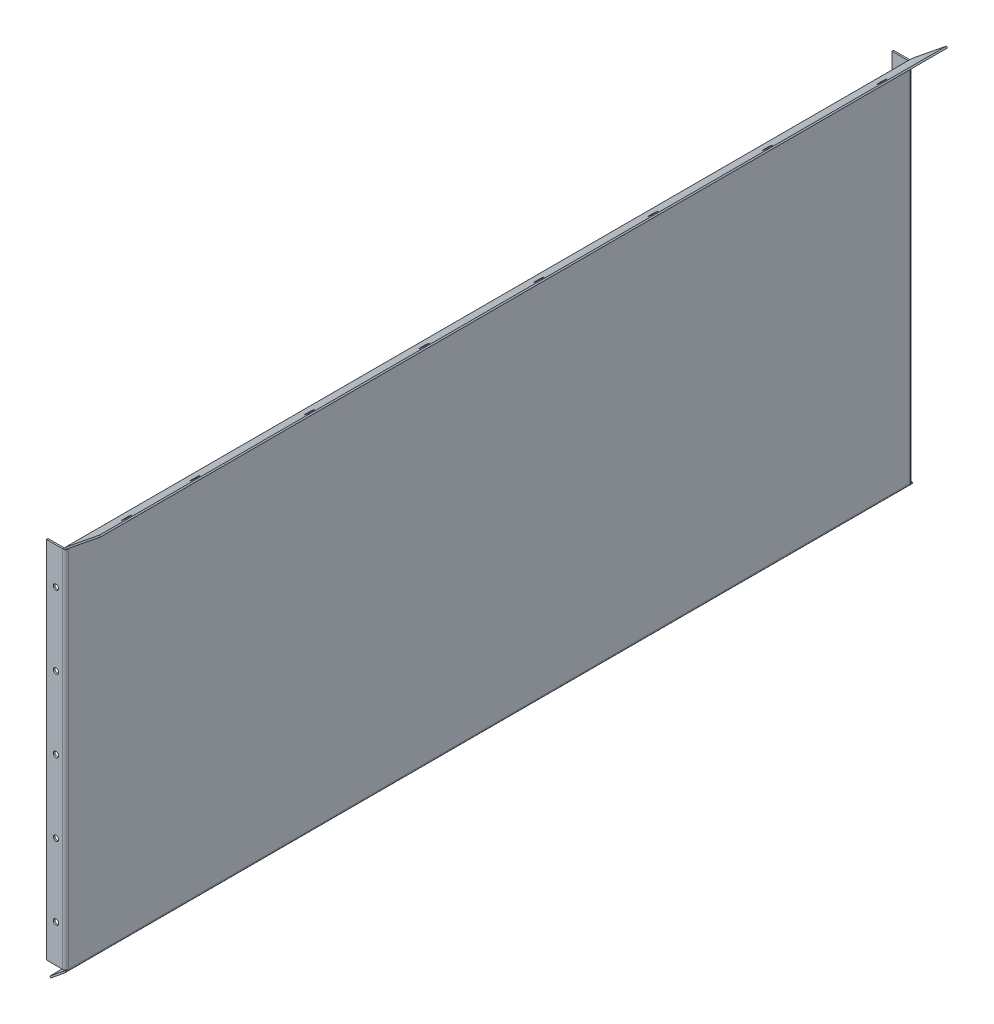
from build123d import *

# Parameters (mm, degrees)
SKETCH1_W                    = 2220
SKETCH1_H                    = 969
BASE_FLANGE1_DEPTH           = 4
EDGE_FLANGE1_START           = -788.522727273
EDGE_FLANGE1_DEPTH           = 2220
EDGE_FLANGE1_2_DEPTH         = 2220
EDGE_FLANGE2_START           = -788.522727273
EDGE_FLANGE2_DEPTH           = 2220
EDGE_FLANGE2_2_DEPTH         = 2220
EDGE_FLANGE3_STRIP_W         = 24
EDGE_FLANGE3_STRIP_H         = 4
EDGE_FLANGE3_STRIP_CUT_DEPTH = 954.890119211
EDGE_FLANGE3_DEPTH           = 954.890119211
EDGE_FLANGE4_STRIP_W         = 24
EDGE_FLANGE4_STRIP_H         = 4
EDGE_FLANGE4_STRIP_CUT_DEPTH = 954.890119211
EDGE_FLANGE4_DEPTH           = 954.890119211
CUT_EXTRUDE1_DEPTH           = 1665.596730593
LPATTERN1_COUNT              = 7
LPATTERN1_PITCH              = 300
CUT_EXTRUDE2_DEPTH           = 1665.596730593
CUT_EXTRUDE2_DEPTH_BACK      = 1665.596730593
SKETCH20_R                   = 7
CUT_EXTRUDE3_DEPTH           = 2327.247497544
LPATTERN2_COUNT              = 5
LPATTERN2_PITCH              = 190
CUT_EXTRUDE4_DEPTH           = 1704.160586281
LPATTERN3_COUNT              = 7
LPATTERN3_PITCH              = 300
CUT_EXTRUDE5_DEPTH           = 1704.160586281
CUT_EXTRUDE5_DEPTH_BACK      = 1704.160586281


# Read off the part's stored shape, not the designer's step: Edge-Flange1, Edge-Flange2
# Sheet-metal steps are written as plain solids
with BuildPart() as part:
    # Sketch1 → Base-Flange1 (new body)
    with BuildSketch(Plane(origin=(0, 0, 0), x_dir=(0, 0, -1), z_dir=(1, 0, 0))):
        with Locations((-321.477272727, 132.136363636)):
            Rectangle(SKETCH1_W, SKETCH1_H)
    extrude(amount=-BASE_FLANGE1_DEPTH)

    # Edge-Flange1 outline → Edge-Flange1 (cut)
    with BuildSketch(Plane.XY.offset(EDGE_FLANGE1_START)):
        with BuildLine():
            ThreePointArc((-4, 609.581423242), (-3.220682275, 613.025512017), (-1.034563128, 615.798590934))
            Line((-1.034563128, 615.798590934), (0, 616.636363636))
            Line((0, 616.636363636), (-4, 616.636363636))
            Line((-4, 616.636363636), (-4, 609.581423242))
        make_face()
    extrude(amount=EDGE_FLANGE1_DEPTH, mode=Mode.SUBTRACT)

    # Edge-Flange1 2 outline → Edge-Flange1 2 (add)
    with BuildSketch(Plane.XY.offset(EDGE_FLANGE1_START)):
        with BuildLine():
            Line((89.257515375, 688.91567443), (0, 616.636363636))
            Line((0, 616.636363636), (0, 609.581423242))
            ThreePointArc((0, 609.581423242), (0.389658863, 611.303467629), (1.482718436, 612.690007088))
            Line((1.482718436, 612.690007088), (91.774796939, 685.807090584))
            Line((91.774796939, 685.807090584), (89.257515375, 688.91567443))
        make_face()
    extrude(amount=EDGE_FLANGE1_2_DEPTH)

    # Edge-Flange2 outline → Edge-Flange2 (cut)
    with BuildSketch(Plane.XY.offset(EDGE_FLANGE2_START)):
        with BuildLine():
            ThreePointArc((0, -345.308695969), (-0.779317725, -348.752784744), (-2.965436872, -351.525863661))
            Line((-2.965436872, -351.525863661), (-4, -352.363636364))
            Line((-4, -352.363636364), (0, -352.363636364))
            Line((0, -352.363636364), (0, -345.308695969))
        make_face()
    extrude(amount=EDGE_FLANGE2_DEPTH, mode=Mode.SUBTRACT)

    # Edge-Flange2 2 outline → Edge-Flange2 2 (add)
    with BuildSketch(Plane.XY.offset(EDGE_FLANGE2_START)):
        with BuildLine():
            Line((-38.857298073, -380.590519783), (-4, -352.363636364))
            Line((-4, -352.363636364), (-4, -345.308695969))
            ThreePointArc((-4, -345.308695969), (-4.389658863, -347.030740356), (-5.482718436, -348.417279815))
            Line((-5.482718436, -348.417279815), (-41.374579637, -377.481935938))
            Line((-41.374579637, -377.481935938), (-38.857298073, -380.590519783))
        make_face()
    extrude(amount=EDGE_FLANGE2_2_DEPTH)

    # Edge-Flange3 strip (across the edge) → Edge-Flange3 strip cut (cut)
    with BuildSketch(Plane(origin=(-4, -345.308695969, 1431.477272727), x_dir=(0, 0, -1), z_dir=(0, 1, 0))):
        with Locations((-4, -2)):
            Rectangle(EDGE_FLANGE3_STRIP_W, EDGE_FLANGE3_STRIP_H)
    extrude(amount=EDGE_FLANGE3_STRIP_CUT_DEPTH, mode=Mode.SUBTRACT)

    # Edge-Flange3 section (across the edge) → Edge-Flange3 (add)
    with BuildSketch(Plane(origin=(-4, -345.308695969, 1431.477272727), x_dir=(0, 0, -1), z_dir=(0, 1, 0))):
        with BuildLine():
            Line((0, 4), (0, 46))
            Line((0, 46), (4, 46))
            Line((4, 46), (4, 4))
            ThreePointArc((4, 4), (5.171572875, 1.171572875), (8, 0))
            Line((8, 0), (8, -4))
            ThreePointArc((8, -4), (2.343145751, -1.656854249), (0, 4))
        make_face()
    extrude(amount=EDGE_FLANGE3_DEPTH)

    # Edge-Flange4 strip (across the edge) → Edge-Flange4 strip cut (cut)
    with BuildSketch(Plane(origin=(-4, 609.581423242, -788.522727273), x_dir=(0, 0, 1), z_dir=(0, -1, 0))):
        with Locations((-4, -2)):
            Rectangle(EDGE_FLANGE4_STRIP_W, EDGE_FLANGE4_STRIP_H)
    extrude(amount=EDGE_FLANGE4_STRIP_CUT_DEPTH, mode=Mode.SUBTRACT)

    # Edge-Flange4 section (across the edge) → Edge-Flange4 (add)
    with BuildSketch(Plane(origin=(-4, 609.581423242, -788.522727273), x_dir=(0, 0, 1), z_dir=(0, -1, 0))):
        with BuildLine():
            Line((0, 4), (0, 46))
            Line((0, 46), (4, 46))
            Line((4, 46), (4, 4))
            ThreePointArc((4, 4), (5.171572875, 1.171572875), (8, 0))
            Line((8, 0), (8, -4))
            ThreePointArc((8, -4), (2.343145751, -1.656854249), (0, 4))
        make_face()
    extrude(amount=EDGE_FLANGE4_DEPTH)

    # Sketch18 → Cut-Extrude1 (cut, symmetric)
    with BuildSketch(Plane(origin=(-301.580689808, 372.42113631, 0), x_dir=(0.7771459614569678, 0.6293203910498413, 0), z_dir=(-0.6293203910498413, 0.7771459614569678, 0))):
        with BuildLine():
            Line((484.914799236, 643.522727273), (484.914799236, 633.522727273))
            ThreePointArc((484.914799236, 633.522727273), (477.914799236, 626.522727273), (470.914799236, 633.522727273))
            Line((470.914799236, 633.522727273), (470.914799236, 643.522727273))
            ThreePointArc((470.914799236, 643.522727273), (477.914799236, 650.522727273), (484.914799236, 643.522727273))
        make_face()
    cut_extrude1 = extrude(amount=CUT_EXTRUDE1_DEPTH, both=True, mode=Mode.SUBTRACT)

    # LPattern1: Cut-Extrude1 ×7
    with Locations(*[(0, 0, i * LPATTERN1_PITCH) for i in range(1, LPATTERN1_COUNT)]):
        add(cut_extrude1, mode=Mode.SUBTRACT)

    # Sketch19 → Cut-Extrude2 (cut, two sides: drawn at the far end of the back side and taken through both)
    with BuildSketch(Plane(origin=(-301.580689808, 372.42113631, 0), x_dir=(0.7771459614569678, 0.6293203910498413, 0), z_dir=(-0.6293203910498413, 0.7771459614569678, 0)).offset(-CUT_EXTRUDE2_DEPTH_BACK)):
        with BuildLine():
            Line((484.914799236, -1336.477272727), (484.914799236, -1346.477272727))
            ThreePointArc((484.914799236, -1346.477272727), (477.914799236, -1353.477272727), (470.914799236, -1346.477272727))
            Line((470.914799236, -1346.477272727), (470.914799236, -1336.477272727))
            ThreePointArc((470.914799236, -1336.477272727), (477.914799236, -1329.477272727), (484.914799236, -1336.477272727))
        make_face()
    extrude(amount=CUT_EXTRUDE2_DEPTH + CUT_EXTRUDE2_DEPTH_BACK, mode=Mode.SUBTRACT)

    # Sketch20 → Cut-Extrude3 (cut, symmetric)
    with BuildSketch(Plane.XY.offset(1431.477272727)):
        with Locations((-25, -246.525863661)):
            Circle(SKETCH20_R)
    cut_extrude3 = extrude(amount=CUT_EXTRUDE3_DEPTH, both=True, mode=Mode.SUBTRACT)

    # LPattern2: Cut-Extrude3 ×5
    with Locations(*[(0, i * LPATTERN2_PITCH, 0) for i in range(1, LPATTERN2_COUNT)]):
        add(cut_extrude3, mode=Mode.SUBTRACT)

    # Sketch21 → Cut-Extrude4 (cut, symmetric)
    with BuildSketch(Plane(origin=(168.230364565, -207.747198844, 0), x_dir=(0.7771459614569676, 0.6293203910498416, 0), z_dir=(-0.6293203910498416, 0.7771459614569677, 0))):
        with BuildLine():
            Line((-237.71116701, 643.522727273), (-237.71116701, 633.522727273))
            ThreePointArc((-237.71116701, 633.522727273), (-244.71116701, 626.522727273), (-251.71116701, 633.522727273))
            Line((-251.71116701, 633.522727273), (-251.71116701, 643.522727273))
            ThreePointArc((-251.71116701, 643.522727273), (-244.71116701, 650.522727273), (-237.71116701, 643.522727273))
        make_face()
    cut_extrude4 = extrude(amount=CUT_EXTRUDE4_DEPTH, both=True, mode=Mode.SUBTRACT)

    # LPattern3: Cut-Extrude4 ×7
    with Locations(*[(0, 0, i * LPATTERN3_PITCH) for i in range(1, LPATTERN3_COUNT)]):
        add(cut_extrude4, mode=Mode.SUBTRACT)

    # Sketch22 → Cut-Extrude5 (cut, two sides: drawn at the far end of the back side and taken through both)
    with BuildSketch(Plane(origin=(168.230364565, -207.747198844, 0), x_dir=(0.7771459614569676, 0.6293203910498416, 0), z_dir=(-0.6293203910498416, 0.7771459614569677, 0)).offset(-CUT_EXTRUDE5_DEPTH_BACK)):
        with BuildLine():
            Line((-237.71116701, -1356.477272727), (-237.71116701, -1366.477272727))
            ThreePointArc((-237.71116701, -1366.477272727), (-244.71116701, -1373.477272727), (-251.71116701, -1366.477272727))
            Line((-251.71116701, -1366.477272727), (-251.71116701, -1356.477272727))
            ThreePointArc((-251.71116701, -1356.477272727), (-244.71116701, -1349.477272727), (-237.71116701, -1356.477272727))
        make_face()
    extrude(amount=CUT_EXTRUDE5_DEPTH + CUT_EXTRUDE5_DEPTH_BACK, mode=Mode.SUBTRACT)


solid = part.part
